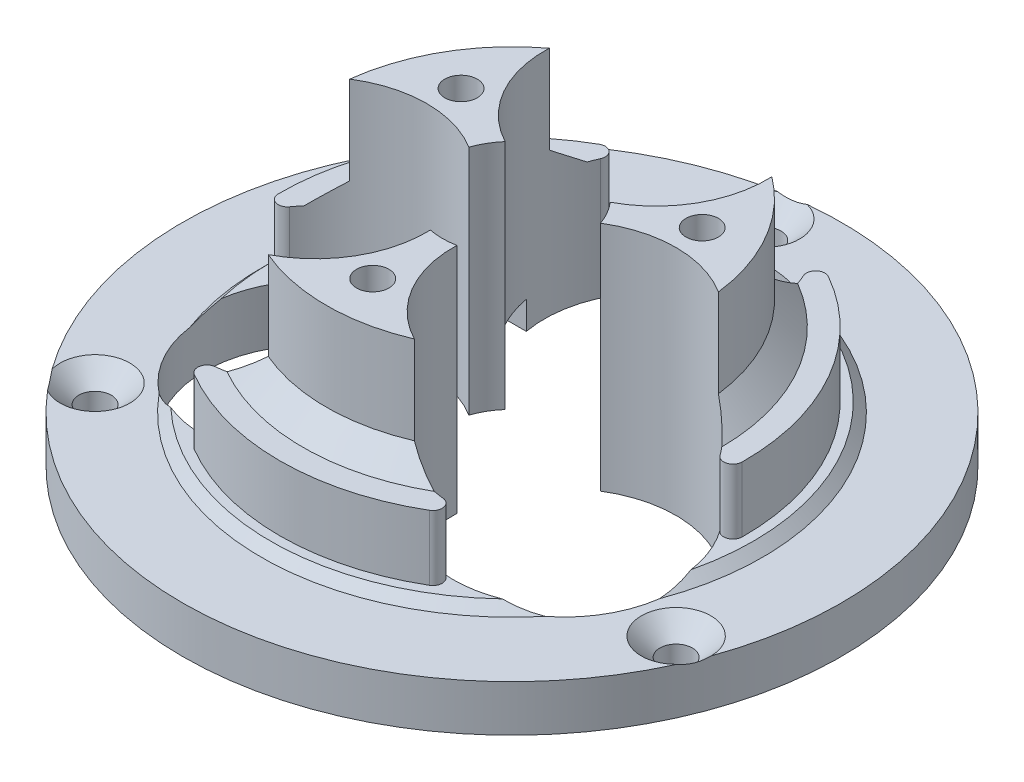
from build123d import *

# Parameters (mm, degrees)
SKETCH1_R           = 35.5
BOSS_EXTRUDE1_DEPTH = 2.5
SKETCH2_R           = 26
BOSS_EXTRUDE2_DEPTH = 1
SKETCH3_R           = 25
BOSS_EXTRUDE3_DEPTH = 19
CHAMFER1_SIZE       = 1
SKETCH4_R           = 12
CUT_EXTRUDE1_DEPTH  = 57.084757288
SKETCH5_R           = 7.5
CUT_EXTRUDE2_DEPTH  = 57.084757332
FILLET1_R           = 1
SKETCH6_R           = 30.018937713
SKETCH6_R_2         = 20
CUT_EXTRUDE3_DEPTH  = 12
CHAMFER2_SIZE       = 2.5
SKETCH7_R           = 1.75
CUT_EXTRUDE4_DEPTH  = 57.084757332
CUT_EXTRUDE5_DEPTH  = 3
SKETCH9_R           = 1.75
CUT_EXTRUDE6_DEPTH  = 55.041650641
CHAMFER3_SIZE       = 2


# Some blends are built 0.0001 mm under size
with BuildPart() as part:
    # Sketch1 → Boss-Extrude1 (new, symmetric)
    with BuildSketch(Plane(origin=(0, 0, 0), x_dir=(1, 0, 0), z_dir=(0, 1, 0))):
        with Locations(Location((0, 0, 0), (0, 0, 270))):
            Circle(SKETCH1_R)
    extrude(amount=BOSS_EXTRUDE1_DEPTH, both=True)

    # Sketch2 → Boss-Extrude2 (add)
    with BuildSketch(Plane(origin=(0, 2.5, 0), x_dir=(1, 0, 0), z_dir=(0, 1, 0))):
        with Locations(Location((0, 0, 0), (0, 0, 270))):
            Circle(SKETCH2_R)
    extrude(amount=BOSS_EXTRUDE2_DEPTH)

    # Sketch3 → Boss-Extrude3 (add)
    with BuildSketch(Plane(origin=(0, 3.5, 0), x_dir=(1, 0, 0), z_dir=(0, 1, 0))):
        with Locations(Location((0, 0, 0), (0, 0, 270))):
            Circle(SKETCH3_R)
    extrude(amount=BOSS_EXTRUDE3_DEPTH)

    # Chamfer1
    chamfer1_edges = [part.edges().sort_by_distance(p)[0] for p in [
        (0, 2.5, -26),
    ]]
    chamfer(chamfer1_edges, length=CHAMFER1_SIZE - 0.0001)  # a hair under: the kernel refuses the full size

    # Sketch4 → Cut-Extrude1 (cut, through all)
    with BuildSketch(Plane(origin=(0, 22.5, 0), x_dir=(1, 0, 0), z_dir=(0, 1, 0))):
        with Locations(Location((0, 15.5, 0), (0, 0, 270))):
            Circle(SKETCH4_R)
        with Locations(Location((13.423393759, -7.75, 0), (0, 0, 270))):
            Circle(SKETCH4_R)
        with Locations(Location((-13.423393759, -7.75, 0), (0, 0, 270))):
            Circle(SKETCH4_R)
    extrude(amount=-CUT_EXTRUDE1_DEPTH, mode=Mode.SUBTRACT)

    # Sketch5 → Cut-Extrude2 (cut, through all)
    with BuildSketch(Plane(origin=(0, 22.5, 0), x_dir=(1, 0, 0), z_dir=(0, 1, 0))):
        Circle(SKETCH5_R)
    extrude(amount=-CUT_EXTRUDE2_DEPTH, mode=Mode.SUBTRACT)

    # Fillet1
    fillet1_edges = [part.edges().sort_by_distance(p)[0] for p in [
        (-15.575022283, 13, 19.555528141),
        (-24.723095296, 13, 3.710600891),
        (24.723095296, 13, 3.710600891),
        (15.575022283, 13, 19.555528141),
        (-9.148073013, 13, -23.266129032),
        (9.148073013, 13, -23.266129032),
    ]]
    fillet(fillet1_edges, radius=FILLET1_R)

    # Sketch6 → Cut-Extrude3 (cut)
    with BuildSketch(Plane(origin=(0, 22.5, 0), x_dir=(1, 0, 0), z_dir=(0, 1, 0))):
        Circle(SKETCH6_R)
        Circle(SKETCH6_R_2, mode=Mode.SUBTRACT)
    extrude(amount=-CUT_EXTRUDE3_DEPTH, mode=Mode.SUBTRACT)

    # Chamfer2
    chamfer2_edges = [part.edges().sort_by_distance(p)[0] for p in [
        (17.320508076, 10.5, -10),
        (-17.320508076, 10.5, -10),
        (0, 10.5, 20),
    ]]
    chamfer(chamfer2_edges, length=CHAMFER2_SIZE)

    # Sketch7 → Cut-Extrude4 (cut, through all)
    with BuildSketch(Plane(origin=(0, 22.5, 0), x_dir=(1, 0, 0), z_dir=(0, 1, 0))):
        with Locations(Location((0, -15, 0), (0, 0, 270))):
            Circle(SKETCH7_R)
        with Locations(Location((-12.990381057, 7.5, 0), (0, 0, 270))):
            Circle(SKETCH7_R)
        with Locations(Location((12.990381057, 7.5, 0), (0, 0, 270))):
            Circle(SKETCH7_R)
    extrude(amount=-CUT_EXTRUDE4_DEPTH, mode=Mode.SUBTRACT)

    # Sketch8 → Cut-Extrude5 (cut)
    with BuildSketch(Plane.XZ.offset(2.5)):
        Polygon((18.879353803, -9), (17.233905535, -6.15), (13.943009001, -6.15), (12.297560734, -9), (13.943009001, -11.85), (17.233905535, -11.85), align=None)
        Polygon((-1.645448267, 17.85), (-3.290896534, 15), (-1.645448267, 12.15), (1.645448267, 12.15), (3.290896534, 15), (1.645448267, 17.85), align=None)
        Polygon((-14.635829324, -13.35), (-11.34493279, -13.35), (-9.699484522, -10.5), (-11.34493279, -7.65), (-14.635829324, -7.65), (-16.281277591, -10.5), align=None)
    extrude(amount=-CUT_EXTRUDE5_DEPTH, mode=Mode.SUBTRACT)

    # Sketch9 → Cut-Extrude6 (cut, through all)
    with BuildSketch(Plane(origin=(0, 2.5, 0), x_dir=(1, 0, 0), z_dir=(0, 1, 0))):
        with Locations(Location((-4.453539231, 31.6885782, 0), (0, 0, 270))):
            Circle(SKETCH9_R)
        with Locations(Location((29.669883346, -11.987410989, 0), (0, 0, 270))):
            Circle(SKETCH9_R)
        with Locations(Location((-25.216344115, -19.70116721, 0), (0, 0, 270))):
            Circle(SKETCH9_R)
    extrude(amount=-CUT_EXTRUDE6_DEPTH, mode=Mode.SUBTRACT)

    # Chamfer3
    # the kernel refuses this chamfer: 2 mm, written as the material it takes off along each edge
    with BuildSketch(Plane(origin=(-4.453539231, 2.5, -31.6885782), x_dir=(0, 0, 1), z_dir=(-1, 0, 0))) as chamfer3_piece_1:
        Polygon((1.75 + CHAMFER3_SIZE, 0), (1.75, -CHAMFER3_SIZE), (1.75, 0), align=None)
    revolve(axis=Axis((-4.453539231, 2.5, -31.6885782), (0, 1, 0)), mode=Mode.SUBTRACT)
    with BuildSketch(Plane(origin=(29.669883346, 2.5, 11.987410989), x_dir=(0, 0, 1), z_dir=(-1, 0, 0))) as chamfer3_piece_2:
        Polygon((1.75 + CHAMFER3_SIZE, 0), (1.75, -CHAMFER3_SIZE), (1.75, 0), align=None)
    revolve(axis=Axis((29.669883346, 2.5, 11.987410989), (0, 1, 0)), mode=Mode.SUBTRACT)
    with BuildSketch(Plane(origin=(-25.216344115, 2.5, 19.70116721), x_dir=(0, 0, 1), z_dir=(-1, 0, 0))) as chamfer3_piece_3:
        Polygon((1.75 + CHAMFER3_SIZE, 0), (1.75, -CHAMFER3_SIZE), (1.75, 0), align=None)
    revolve(axis=Axis((-25.216344115, 2.5, 19.70116721), (0, 1, 0)), mode=Mode.SUBTRACT)


solid = part.part
